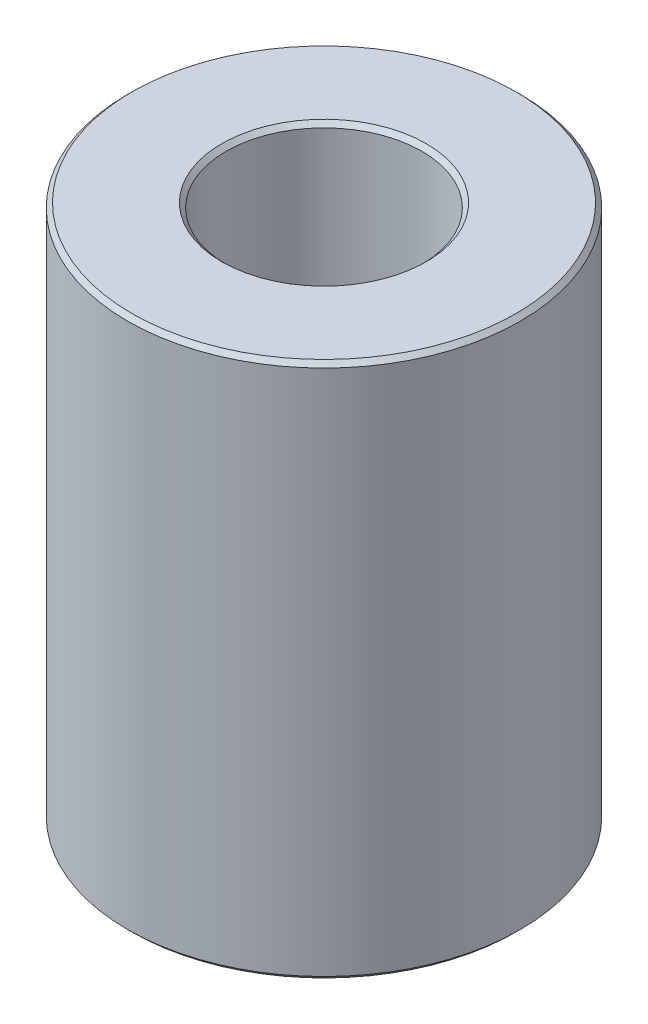
from build123d import *

# Parameters (mm, degrees)
SKETCH1_R           = 35
BOSS_EXTRUDE1_DEPTH = 95.466231076
SKETCH2_R           = 17.444702048
CUT_EXTRUDE1_DEPTH  = 108.535116478
CHAMFER1_SIZE       = 0.78129232


with BuildPart() as part:
    # Sketch1 → Boss-Extrude1 (new body)
    with BuildSketch(Plane(origin=(0, 0, 0), x_dir=(1, 0, 0), z_dir=(0, 1, 0))):
        Circle(SKETCH1_R)
    extrude(amount=BOSS_EXTRUDE1_DEPTH)

    # Sketch2 → Cut-Extrude1 (cut, through all)
    with BuildSketch(Plane(origin=(0, 0, 0), x_dir=(1, 0, 0), z_dir=(0, 1, 0))):
        Circle(SKETCH2_R)
    extrude(amount=CUT_EXTRUDE1_DEPTH, mode=Mode.SUBTRACT)

    # Chamfer1
    chamfer1_edges = [part.edges().sort_by_distance(p)[0] for p in [
        (-17.444702048, 95.466231076, 0),
        (-17.444702048, 0, 0),
        (-35, 0, 0),
        (-35, 95.466231076, 0),
    ]]
    chamfer(chamfer1_edges, length=CHAMFER1_SIZE)


solid = part.part
